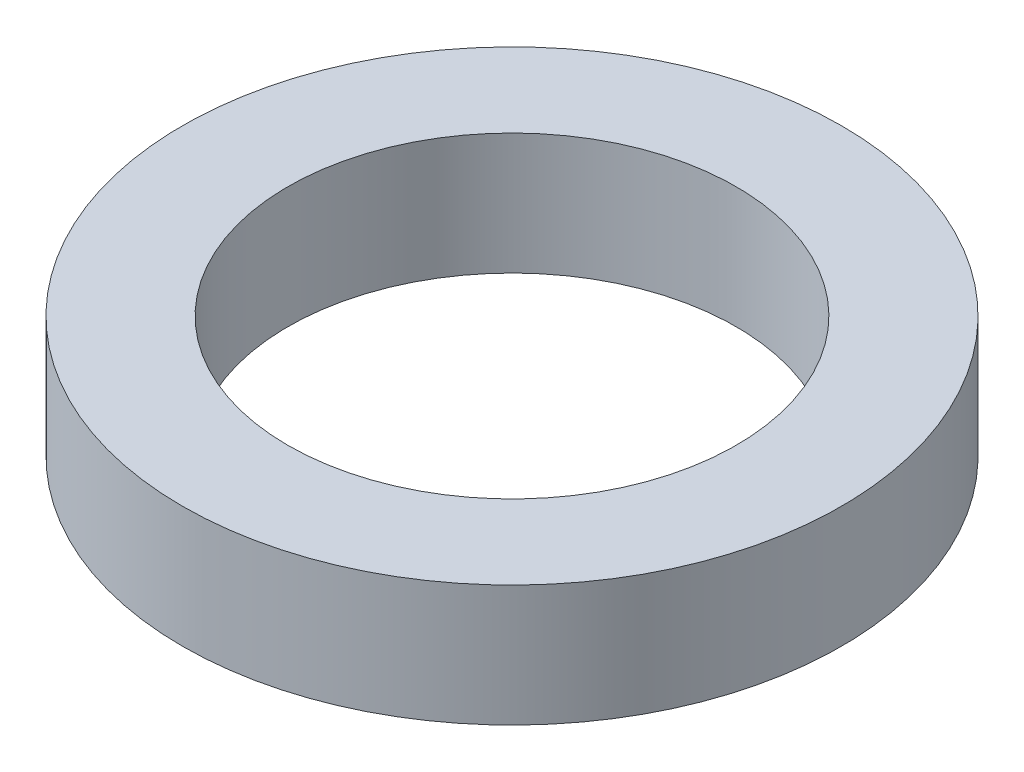
from build123d import *

# Parameters (mm, degrees)
SKETCH1_R           = 62.5
BOSS_EXTRUDE1_DEPTH = 23
SKETCH2_R           = 42.5
CUT_EXTRUDE1_DEPTH  = 92.331812639


with BuildPart() as part:
    # Sketch1 → Boss-Extrude1 (new body)
    with BuildSketch(Plane(origin=(0, 0, 0), x_dir=(1, 0, 0), z_dir=(0, 1, 0))):
        Circle(SKETCH1_R)
    extrude(amount=BOSS_EXTRUDE1_DEPTH)

    # Sketch2 → Cut-Extrude1 (cut, through all)
    with BuildSketch(Plane(origin=(0, 0, 0), x_dir=(1, 0, 0), z_dir=(0, 1, 0))):
        Circle(SKETCH2_R)
    extrude(amount=CUT_EXTRUDE1_DEPTH, mode=Mode.SUBTRACT)


solid = part.part
